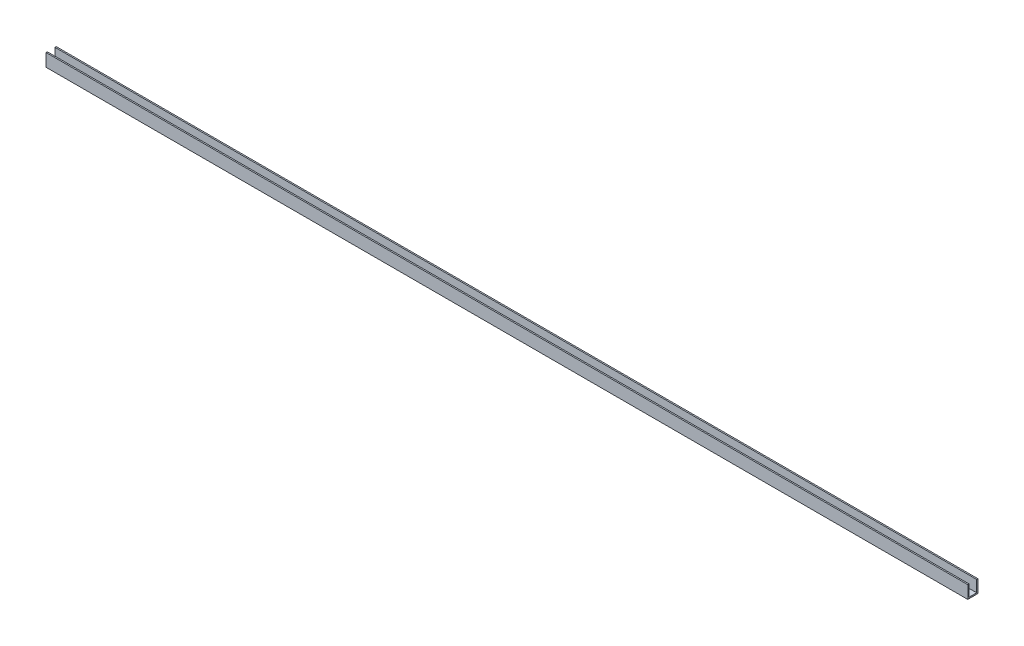
from build123d import *

# Parameters (mm, degrees)
BOSS_EXTRUDE1_DEPTH = 720


with BuildPart() as part:
    # Sketch1 → Boss-Extrude1 (new body)
    with BuildSketch(Plane(origin=(0, 0, 0), x_dir=(0, 0, -1), z_dir=(1, 0, 0))):
        Polygon((-4, 0), (4, 0), (4, 10), (3, 10), (3, 1), (-3, 1), (-3, 10), (-4, 10), align=None)
    extrude(amount=BOSS_EXTRUDE1_DEPTH)


solid = part.part
